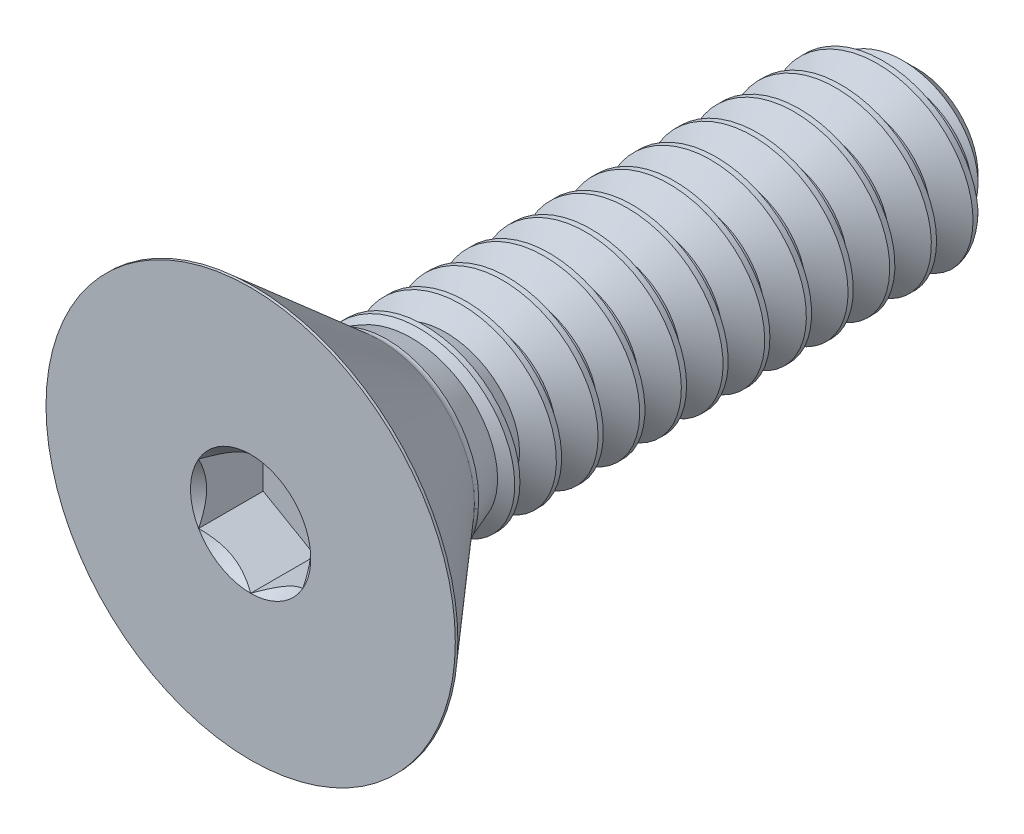
from build123d import *

# Parameters (mm, degrees)
CUT_EXTRUDE1_DEPTH = 1.2319
CUT_SWEEP1_PITCH   = 0.79375
CUT_SWEEP1_TO      = 10.10946


with BuildPart() as part:
    # Sketch11 → Revolve1 (revolve)
    with BuildSketch(Plane(origin=(0, 0, 0), x_dir=(0, 0, -1), z_dir=(1, 0, 0))):
        with BuildLine():
            Line((-6.300724, 3.8989), (-3.8862, 1.799986309))
            ThreePointArc((-3.8862, 1.799986309), (-3.8271142, 1.764833952), (-3.75945956, 1.7526))
            Line((-3.75945956, 1.7526), (5.7546875, 1.7526))
            Line((5.7546875, 1.7526), (6.35, 1.1572875))
            Line((6.35, 1.1572875), (6.35, 0))
            Line((6.35, 0), (-6.35, 0))
            Line((-6.35, 0), (-6.35, 3.8989))
            Line((-6.35, 3.8989), (-6.300724, 3.8989))
        make_face()
    revolve(axis=Axis((0, 0, -6.35), (0, 0, 1)))

    # Cut-Extrude2 cone 1 section (through the dimple's axis) → Cut-Extrude2 (revolve, cut)
    with BuildSketch(Plane(origin=(0, 0, 6.35), x_dir=(0, -1, 0), z_dir=(1, 0, 0))):
        Polygon((0, 0), (1.14567944, 0), (0, 1.14567944), align=None)
    revolve(axis=Axis((0, 0, 6.35), (0, 0, -1)), mode=Mode.SUBTRACT)

    # Sketch9 → Cut-Extrude1 (cut)
    with BuildSketch(Plane.XY.offset(6.35)):
        Polygon((0.9921875, -0.57283972), (0.9921875, 0.57283972), (0, 1.14567944), (-0.9921875, 0.57283972), (-0.9921875, -0.57283972), (0, -1.14567944), align=None)
    extrude(amount=-CUT_EXTRUDE1_DEPTH, mode=Mode.SUBTRACT)


with BuildPart() as body_2:
    # Split1: the piece on the far side of the plane
    add(part.part)
    split(bisect_by=Plane.XY.offset(3.75945956), keep=Keep.BOTTOM)

    # Cut-Sweep1: arcs per turn and ends read off the stored shape
    # Cut-Sweep1: the profile of Sketch4 screwed along a right-hand helix through 16 turns, 8 arcs to a turn; built about Z, then put on its axis
    cut_sweep1_z = Axis((0, 0, 0), (0, 0, 1))
    cut_sweep1_corners = [(1.795562979, 0, 0.024804688), (1.795562979, 0, -0.719335938), (1.237044252, 0, -0.396875), (1.237044252, 0, -0.29765625)]
    with BuildLine(mode=Mode.PRIVATE) as cut_sweep1_profile:
        Line(cut_sweep1_corners[0], cut_sweep1_corners[1])
        Line(cut_sweep1_corners[1], cut_sweep1_corners[2])
        Line(cut_sweep1_corners[2], cut_sweep1_corners[3])
        Line(cut_sweep1_corners[3], cut_sweep1_corners[0])
    cut_sweep1_cap = Face(cut_sweep1_profile.wire())
    cut_sweep1_turn_angles = [0, 22.5, 45, 67.5, 90, 112.5, 135, 157.5, 180, 202.5, 225, 247.5, 270, 292.5, 315, 337.5, 360]
    cut_sweep1_turn_weights = [1, 0.9238795325112867, 1, 0.9238795325112867, 1, 0.9238795325112867, 1, 0.9238795325112867, 1, 0.9238795325112867, 1, 0.9238795325112867, 1, 0.9238795325112867, 1, 0.9238795325112867, 1]
    cut_sweep1_turn_rails = [Edge.make_bspline([Vector(p[0], p[1], 0).rotate(cut_sweep1_z, cut_sweep1_turn_angles[k]) / cut_sweep1_turn_weights[k] + Vector(0, 0, p[2] + CUT_SWEEP1_PITCH * cut_sweep1_turn_angles[k] / 360) for k in range(17)], [0, 0, 0, 1, 1, 2, 2, 3, 3, 4, 4, 5, 5, 6, 6, 7, 7, 8, 8, 8], 2, cut_sweep1_turn_weights) for p in cut_sweep1_corners]
    cut_sweep1_turn_sides = [Face.make_surface_from_curves(cut_sweep1_turn_rails[p[0]], cut_sweep1_turn_rails[p[1]]) for p in [(0, 1), (1, 2), (2, 3), (3, 0)]]
    cut_sweep1 = Plane(origin=(0, 0, -6.35), x_dir=(0, 1, 0), z_dir=(0, 0, 1)) * split(Solid(Shell([*[p.moved(Location((0, 0, CUT_SWEEP1_PITCH * i))) for i in range(16) for p in cut_sweep1_turn_sides], cut_sweep1_cap, cut_sweep1_cap.rotate(cut_sweep1_z, 5760).moved(Location((0, 0, CUT_SWEEP1_PITCH * 5760 / 360)))])), bisect_by=Plane.XY.offset(CUT_SWEEP1_TO), keep=Keep.BOTTOM, mode=Mode.PRIVATE)
    add(cut_sweep1, mode=Mode.SUBTRACT)


with BuildPart() as part_1:
    add(part.part)

    # Split1
    split(bisect_by=Plane.XY.offset(3.75945956), keep=Keep.TOP)

    add(body_2.part)  # Boss-Extrude2 merges body 2
    # Boss-Extrude2 cone 1 section (through the dimple's axis) → Boss-Extrude2 (revolve)
    with BuildSketch(Plane(origin=(0, 0, 3.75945956), x_dir=(0, -1, 0), z_dir=(1, 0, 0))):
        Polygon((0, 0), (1.7526, 0), (0, 4.815228925), align=None)
    revolve(axis=Axis((0, 0, 3.75945956), (0, 0, -1)))


solid = part_1.part
